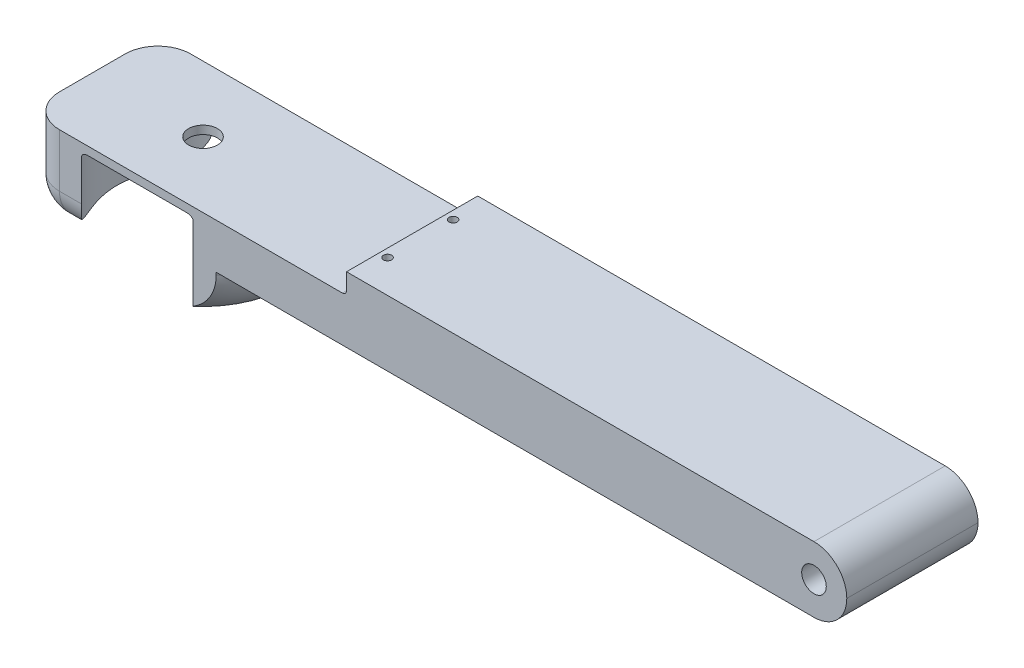
from build123d import *
from build123d.topology import SkipClean

# Parameters (mm, degrees)
SKETCH1_W           = 10
SKETCH1_H           = 16
BOSS_EXTRUDE1_DEPTH = 8
FILLET1_R           = 4
SKETCH2_R           = 1.5
CUT_EXTRUDE1_DEPTH  = 16
SKETCH3_W           = 51
SKETCH3_H           = 16
BOSS_EXTRUDE2_DEPTH = 8
SKETCH4_W           = 36
SKETCH4_H           = 16
BOSS_EXTRUDE3_DEPTH = 4.5
SKETCH6_R           = 10.5
CUT_EXTRUDE6_DEPTH  = 16
SKETCH11_W          = 3
SKETCH11_H          = 16
BOSS_EXTRUDE4_DEPTH = 4.5
FILLET3_R           = 4
BOSS_EXTRUDE5_DEPTH = 1
SKETCH14_R          = 1.75
CUT_EXTRUDE7_DEPTH  = 1
BOSS_EXTRUDE6_DEPTH = 5
FILLET4_R           = 6.5
FILLET5_R           = 0.5
FILLET6_R           = 4
FILLET7_R           = 0.5
SKETCH17_W          = 51
SKETCH17_H          = 12.2
CUT_EXTRUDE9_DEPTH  = 6
SKETCH18_R          = 0.5
CUT_EXTRUDE10_DEPTH = 8


# Some blends are built 0.0001 mm under size
with BuildPart() as part:
    # Sketch1 → Boss-Extrude1 (new body)
    with BuildSketch(Plane(origin=(0, 0, 0), x_dir=(1, 0, 0), z_dir=(0, 1, 0))):
        Rectangle(SKETCH1_W, SKETCH1_H)
    extrude(amount=BOSS_EXTRUDE1_DEPTH)

    # Fillet1
    fillet1_edges = [part.edges().sort_by_distance(p)[0] for p in [
        (5, 0, 0),
        (5, 8, 0),
    ]]
    fillet(fillet1_edges, radius=FILLET1_R - 0.0001)  # a hair under: the kernel refuses the full size

    # Sketch2 → Cut-Extrude1 (cut)
    with BuildSketch(Plane.XY.offset(8)):
        with Locations((1, 4)):
            Circle(SKETCH2_R)
    extrude(amount=-CUT_EXTRUDE1_DEPTH, mode=Mode.SUBTRACT)

    # Sketch3 → Boss-Extrude2 (add)
    with BuildSketch(Plane(origin=(0, 0, 0), x_dir=(1, 0, 0), z_dir=(0, 1, 0))):
        with Locations((-30.5, 0)):
            Rectangle(SKETCH3_W, SKETCH3_H)
    extrude(amount=BOSS_EXTRUDE2_DEPTH)

    # Sketch4 → Boss-Extrude3 (add)
    with BuildSketch(Plane(origin=(0, 0, 0), x_dir=(1, 0, 0), z_dir=(0, 1, 0))):
        with Locations((-74, 0)):
            Rectangle(SKETCH4_W, SKETCH4_H)
    extrude(amount=BOSS_EXTRUDE3_DEPTH)

    # Sketch6 → Cut-Extrude6 (cut)
    with BuildSketch(Plane(origin=(0, 4.5, 0), x_dir=(1, 0, 0), z_dir=(0, 1, 0))):
        with Locations((-81.5, 0)):
            Circle(SKETCH6_R)
    extrude(amount=-CUT_EXTRUDE6_DEPTH, mode=Mode.SUBTRACT)


with BuildPart() as cut_extrude6_piece_1:
    # of the separate pieces the step leaves, piece 1, a body of its own (cut_extrude6_pieces)
    add(part.part.solids().sort_by_distance((5, 3.9999, -8))[0])



with BuildPart() as cut_extrude6_piece_2:
    # of the separate pieces the step leaves, piece 2, a body of its own (cut_extrude6_pieces)
    add(part.part.solids().sort_by_distance((-88.300735254, 4.5, 8))[0])



with BuildPart() as cut_extrude6_piece_3:
    # of the separate pieces the step leaves, piece 3, a body of its own (cut_extrude6_pieces)
    add(part.part.solids().sort_by_distance((-88.300735254, 0, -8))[0])


with BuildPart() as cut_extrude6_piece_2_1:
    add(cut_extrude6_piece_2.part)

    add(cut_extrude6_piece_3.part)  # Boss-Extrude4 merges Cut-Extrude6 piece 3
    # Sketch11 → Boss-Extrude4 (add)
    with BuildSketch(Plane(origin=(0, 0, 0), x_dir=(1, 0, 0), z_dir=(0, 1, 0))):
        with Locations((-93.5, 0)):
            Rectangle(SKETCH11_W, SKETCH11_H)
    extrude(amount=BOSS_EXTRUDE4_DEPTH)

    # Fillet3
    fillet3_edges = [cut_extrude6_piece_2_1.edges().sort_by_distance(p)[0] for p in [
        (-95, 2.25, 8),
        (-95, 2.25, -8),
    ]]
    fillet(fillet3_edges, radius=FILLET3_R)


with BuildPart() as cut_extrude6_piece_1_1:
    add(cut_extrude6_piece_1.part)

    add(cut_extrude6_piece_2_1.part)  # Boss-Extrude5 merges Cut-Extrude6 piece 2
    # Sketch13 → Boss-Extrude5 (add)
    with BuildSketch(Plane(origin=(0, 4.5, 0), x_dir=(1, 0, 0), z_dir=(0, 1, 0))):
        with BuildLine():
            Line((-88.300735254, 8), (-91, 8))
            ThreePointArc((-91, 8), (-93.828427125, 6.828427125), (-95, 4))
            Line((-95, 4), (-95, -4))
            ThreePointArc((-95, -4), (-93.828427125, -6.828427125), (-91, -8))
            Line((-91, -8), (-88.300735254, -8))
            Line((-88.300735254, -8), (-74.699264746, -8))
            Line((-74.699264746, -8), (-56, -8))
            Line((-56, -8), (-56, 8))
            Line((-56, 8), (-74.699264746, 8))
            Line((-74.699264746, 8), (-88.300735254, 8))
        make_face()
    extrude(amount=BOSS_EXTRUDE5_DEPTH)

    # Sketch14 → Cut-Extrude7 (cut)
    with BuildSketch(Plane(origin=(0, 5.5, 0), x_dir=(1, 0, 0), z_dir=(0, 1, 0))):
        with Locations(Location((-81.5, 0, 0), (0, 0, 270))):
            Circle(SKETCH14_R)
    extrude(amount=-CUT_EXTRUDE7_DEPTH, mode=Mode.SUBTRACT)

    # Sketch15 → Boss-Extrude6 (add)
    with SkipClean():  # the faces are left unmerged after this step: merging them gives an invalid solid
        with BuildSketch(Plane.XZ):
            with BuildLine():
                Line((-91, 8), (-88.300735254, 8))
                ThreePointArc((-88.300735254, 8), (-92, 0), (-88.300735254, -8))
                Line((-88.300735254, -8), (-91, -8))
                ThreePointArc((-91, -8), (-93.828427125, -6.828427125), (-95, -4))
                Line((-95, -4), (-95, 4))
                ThreePointArc((-95, 4), (-93.828427125, 6.828427125), (-91, 8))
            make_face()
            with BuildLine():
                Line((-71.895313644, 8), (-74.699264746, 8))
                ThreePointArc((-74.699264746, 8), (-71, 0), (-74.699264746, -8))
                Line((-74.699264746, -8), (-71.895313644, -8))
                ThreePointArc((-71.895313644, -8), (-69, 0), (-71.895313644, 8))
            make_face()
        extrude(amount=BOSS_EXTRUDE6_DEPTH)

    # Fillet4
    # the kernel refuses this fillet: 6.5 mm, written as the material it takes off along each edge
    with BuildSketch(Plane(origin=(-81.5, -5, 0), x_dir=(-0.06203986114443866, 0, -0.998073672445666), z_dir=(-0.998073672445666, 0, 0.06203986114443866))) as fillet4_piece_1:
        with BuildLine():
            CenterArc((6, -4.69041576), FILLET4_R, 0, 46.18693854)
            Line((10.5, 0), (12.5, 0))
            Line((12.5, 0), (12.5, -4.69041576))
        make_face()
    revolve(axis=Axis((-81.5, -5, 0), (0, -1, 0)), revolution_arc=187.113812842, mode=Mode.SUBTRACT)

    # Fillet5
    fillet5_edges = [cut_extrude6_piece_1_1.edges().sort_by_distance(p)[0] for p in [
        (-71, 4.5, 0),
        (-92, 4.5, 0),
    ]]
    fillet(fillet5_edges, radius=FILLET5_R)

    # Fillet6
    # the kernel refuses this fillet: 4 mm, written as the material it takes off along each edge
    with BuildSketch(Plane(origin=(-91, -5, 8), x_dir=(0, 0, -1), z_dir=(1, 0, 0))) as fillet6_piece_1:
        with BuildLine():
            CenterArc((FILLET6_R, FILLET6_R), FILLET6_R, 180, 90)
            Line((0, FILLET6_R), (0, 0))
            Line((0, 0), (FILLET6_R, 0))
        make_face()
    extrude(amount=12.699264746, mode=Mode.SUBTRACT)
    with BuildSketch(Plane(origin=(-91, -5, 4), x_dir=(-1, 0, 0), z_dir=(0, 0, -1))) as fillet6_piece_2:
        with BuildLine():
            CenterArc((4 - FILLET6_R, FILLET6_R), FILLET6_R, 270, 90)
            Line((4, FILLET6_R), (4, 0))
            Line((4, 0), (4 - FILLET6_R, 0))
        make_face()
    revolve(axis=Axis((-91, -5, 4), (0, 1, 0)), revolution_arc=90, mode=Mode.SUBTRACT)
    with BuildSketch(Plane(origin=(-78.300735254, -5, -8), x_dir=(0, 1, 0), z_dir=(-1, 0, 0))) as fillet6_piece_3:
        with BuildLine():
            CenterArc((FILLET6_R, -FILLET6_R), FILLET6_R, 90, 90)
            Line((0, -FILLET6_R), (0, 0))
            Line((0, 0), (FILLET6_R, 0))
        make_face()
    extrude(amount=12.699264746, mode=Mode.SUBTRACT)
    with BuildSketch(Plane(origin=(-91, -5, -4), x_dir=(0, 0, -1), z_dir=(1, 0, 0))) as fillet6_piece_4:
        with BuildLine():
            CenterArc((4 - FILLET6_R, FILLET6_R), FILLET6_R, 270, 90)
            Line((4, FILLET6_R), (4, 0))
            Line((4, 0), (4 - FILLET6_R, 0))
        make_face()
    revolve(axis=Axis((-91, -5, -4), (0, 1, 0)), revolution_arc=90, mode=Mode.SUBTRACT)
    with BuildSketch(Plane(origin=(-95, -5, -4), x_dir=(1, 0, 0), z_dir=(0, 0, 1))) as fillet6_piece_5:
        with BuildLine():
            CenterArc((FILLET6_R, FILLET6_R), FILLET6_R, 180, 90)
            Line((0, FILLET6_R), (0, 0))
            Line((0, 0), (FILLET6_R, 0))
        make_face()
    extrude(amount=8, mode=Mode.SUBTRACT)

    # Fillet7
    fillet7_edges = [cut_extrude6_piece_1_1.edges().sort_by_distance(p)[0] for p in [
        (-56, 5.5, 0),
    ]]
    fillet(fillet7_edges, radius=FILLET7_R)

    # Sketch17 → Cut-Extrude9 (cut)
    with BuildSketch(Plane.XZ):
        with Locations((-28.5, 0)):
            Rectangle(SKETCH17_W, SKETCH17_H)
    extrude(amount=-CUT_EXTRUDE9_DEPTH, mode=Mode.SUBTRACT)

    # Sketch18 → Cut-Extrude10 (cut)
    with BuildSketch(Plane.XZ):
        with Locations(Location((-55, 4, 0), (0, 0, 270))):
            Circle(SKETCH18_R)
        with Locations(Location((-55, -4, 0), (0, 0, 270))):
            Circle(SKETCH18_R)
    extrude(amount=-CUT_EXTRUDE10_DEPTH, mode=Mode.SUBTRACT)


solid = cut_extrude6_piece_1_1.part
